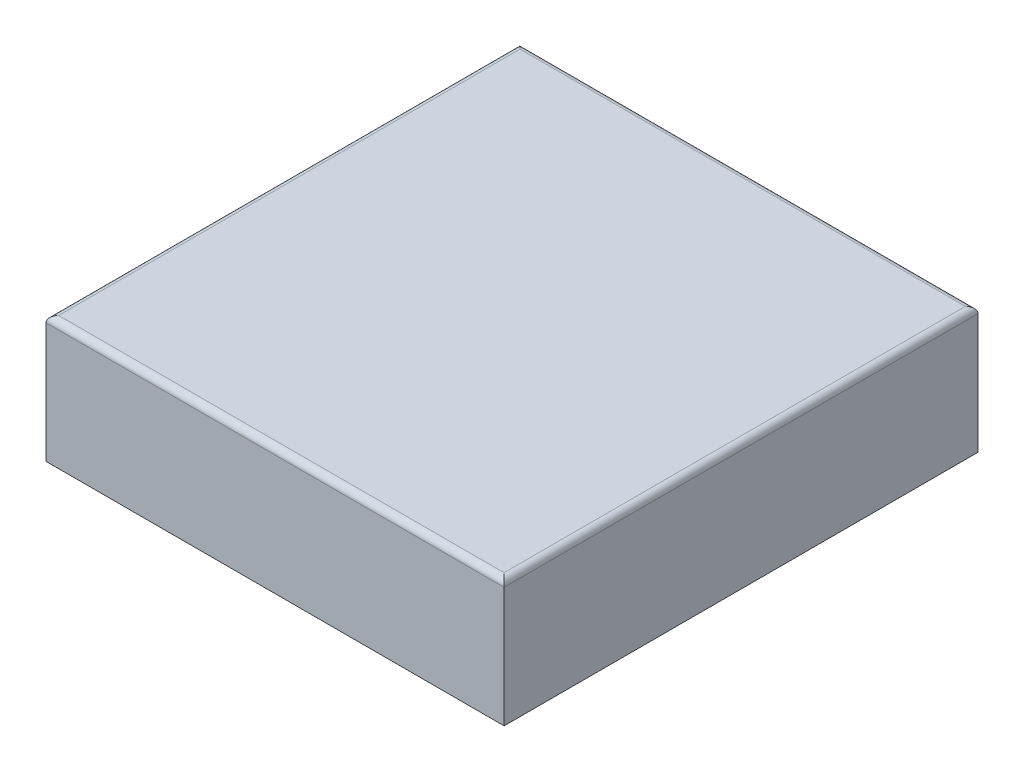
from build123d import *

# Parameters (mm, degrees)
SKETCH2_W                                            = 184.15
SKETCH2_H                                            = 190.5
BOSS_EXTRUDE1_DEPTH                                  = 50.8
SHELL1_T                                             = -5.08
CSK_FOR_M6_HEX_SOCKET_COUNTERSUNK_CAP_SC_D           = 6.6
CSK_FOR_M6_HEX_SOCKET_COUNTERSUNK_CAP_SC_DEPTH       = 11.733159957
CSK_FOR_M6_HEX_SOCKET_COUNTERSUNK_CAP_SC_CSINK_D     = 13.44
CSK_FOR_M6_HEX_SOCKET_COUNTERSUNK_CAP_SC_CSINK_ANGLE = 90
CSK_FOR_M6_HEX_SOCKET_COUNTERSUNK_CAP_SC_TIP         = 1.982840043
FILLET1_R                                            = 2.54


with BuildPart() as part:
    # Sketch2 → Boss-Extrude1 (new body)
    with BuildSketch(Plane(origin=(0, 0, 0), x_dir=(1, 0, 0), z_dir=(0, 1, 0))):
        Rectangle(SKETCH2_W, SKETCH2_H)
    extrude(amount=-BOSS_EXTRUDE1_DEPTH)

    # Shell1
    shell1_openings = [part.faces().sort_by_distance(p)[0] for p in [
        (0, -50.8, 0),
    ]]
    offset(amount=SHELL1_T, openings=shell1_openings, kind=Kind.INTERSECTION)

    # Loft1: read off the stored shape, not the designer's step
    # Loft1: loft between two sections, ruled curve by curve
    loft1_from = [
        Edge.make_bspline([(68.241223487, -26.310119776, -101.6), (68.532768976, -26.616911457, -101.6), (68.863871753, -26.909333008, -101.6), (69.601572379, -27.439191099, -101.6), (70.008225028, -27.676441112, -101.6), (70.882099248, -28.069631586, -101.6), (71.349251098, -28.225355381, -101.6), (72.31767022, -28.435607084, -101.6), (72.818735502, -28.489985667, -101.6), (73.821125836, -28.489985667, -101.6), (74.322191118, -28.435607084, -101.6), (75.29061024, -28.225355381, -101.6), (75.757762089, -28.069631586, -101.6), (76.631636309, -27.676441112, -101.6), (77.038288959, -27.439191099, -101.6), (77.775989584, -26.909333008, -101.6), (78.107092362, -26.616911457, -101.6), (78.39863785, -26.310119776, -101.6)], [0, 0, 0, 0, 0.125, 0.125, 0.25, 0.25, 0.375, 0.375, 0.5, 0.5, 0.625, 0.625, 0.75, 0.75, 0.875, 0.875, 1, 1, 1, 1], 3),
        Edge.make_bspline([(78.39863785, -26.310119776, -101.6), (78.675694815, -26.018574288, -101.6), (78.937226358, -25.692808769, -101.6), (79.407739121, -24.977845102, -101.6), (79.616581189, -24.588623733, -101.6), (79.961046476, -23.760489668, -101.6), (80.096520237, -23.321639377, -101.6), (80.279103538, -22.416392759, -101.6), (80.326114413, -21.950142771, -101.6), (80.326114413, -21.017461075, -101.6), (80.279103538, -20.551211086, -101.6), (80.096520237, -19.645964468, -101.6), (79.961046476, -19.207114178, -101.6), (79.616581189, -18.378980112, -101.6), (79.407739121, -17.989758743, -101.6), (78.937226358, -17.274795077, -101.6), (78.675694815, -16.949029558, -101.6), (78.39863785, -16.657484069, -101.6)], [0, 0, 0, 0, 0.125, 0.125, 0.25, 0.25, 0.375, 0.375, 0.5, 0.5, 0.625, 0.625, 0.75, 0.75, 0.875, 0.875, 1, 1, 1, 1], 3),
        Edge.make_bspline([(68.241223487, -16.657484069, -101.6), (67.964166523, -16.949029558, -101.6), (67.70263498, -17.274795077, -101.6), (67.232122217, -17.989758743, -101.6), (67.023280149, -18.378980112, -101.6), (66.678814862, -19.207114178, -101.6), (66.543341101, -19.645964468, -101.6), (66.3607578, -20.551211086, -101.6), (66.313746925, -21.017461075, -101.6), (66.313746925, -21.950142771, -101.6), (66.3607578, -22.416392759, -101.6), (66.543341101, -23.321639377, -101.6), (66.678814862, -23.760489668, -101.6), (67.023280149, -24.588623733, -101.6), (67.232122217, -24.977845102, -101.6), (67.70263498, -25.692808769, -101.6), (67.964166523, -26.018574288, -101.6), (68.241223487, -26.310119776, -101.6)], [0, 0, 0, 0, 0.125, 0.125, 0.25, 0.25, 0.375, 0.375, 0.5, 0.5, 0.625, 0.625, 0.75, 0.75, 0.875, 0.875, 1, 1, 1, 1], 3),
        Edge.make_bspline([(78.39863785, -16.657484069, -101.6), (78.107092362, -16.350692388, -101.6), (77.775989584, -16.058270838, -101.6), (77.038288959, -15.528412746, -101.6), (76.631636309, -15.291162733, -101.6), (75.757762089, -14.89797226, -101.6), (75.29061024, -14.742248464, -101.6), (74.322191118, -14.531996762, -101.6), (73.821125836, -14.477618178, -101.6), (72.818735502, -14.477618178, -101.6), (72.31767022, -14.531996762, -101.6), (71.349251098, -14.742248464, -101.6), (70.882099248, -14.89797226, -101.6), (70.008225028, -15.291162733, -101.6), (69.601572379, -15.528412746, -101.6), (68.863871753, -16.058270838, -101.6), (68.532768976, -16.350692388, -101.6), (68.241223487, -16.657484069, -101.6)], [0, 0, 0, 0, 0.125, 0.125, 0.25, 0.25, 0.375, 0.375, 0.5, 0.5, 0.625, 0.625, 0.75, 0.75, 0.875, 0.875, 1, 1, 1, 1], 3),
    ]
    loft1_to = [
        Edge.make_bspline([(62.059516528, -35.333897225, -95.25), (63.205579438, -35.333897225, -95.25), (64.351642348, -35.333897225, -95.25), (66.643768167, -35.333897225, -95.25), (67.789831077, -35.333897225, -95.25), (70.081956897, -35.333897225, -95.25), (71.228019807, -35.333897225, -95.25), (73.520145626, -35.333897225, -95.25), (74.666208536, -35.333897225, -95.25), (76.958334356, -35.333897225, -95.25), (78.104397266, -35.333897225, -95.25), (80.396523085, -35.333897225, -95.25), (81.542585995, -35.333897225, -95.25), (83.834711815, -35.333897225, -95.25), (84.980774725, -35.333897225, -95.25), (87.272900544, -35.333897225, -95.25), (88.418963454, -35.333897225, -95.25), (89.565026364, -35.333897225, -95.25)], [0, 0, 0, 0, 0.125, 0.125, 0.25, 0.25, 0.375, 0.375, 0.5, 0.5, 0.625, 0.625, 0.75, 0.75, 0.875, 0.875, 1, 1, 1, 1], 3),
        Edge.make_bspline([(89.565026364, -35.333897225, -95.25), (89.565026364, -34.244788582, -95.25), (89.565026364, -33.15567994, -95.25), (89.565026364, -30.977462655, -95.25), (89.565026364, -29.888354013, -95.25), (89.565026364, -27.710136729, -95.25), (89.565026364, -26.621028086, -95.25), (89.565026364, -24.442810802, -95.25), (89.565026364, -23.353702159, -95.25), (89.565026364, -21.175484875, -95.25), (89.565026364, -20.086376233, -95.25), (89.565026364, -17.908158948, -95.25), (89.565026364, -16.819050306, -95.25), (89.565026364, -14.640833021, -95.25), (89.565026364, -13.551724379, -95.25), (89.565026364, -11.373507094, -95.25), (89.565026364, -10.284398452, -95.25), (89.565026364, -9.19528981, -95.25)], [0, 0, 0, 0, 0.125, 0.125, 0.25, 0.25, 0.375, 0.375, 0.5, 0.5, 0.625, 0.625, 0.75, 0.75, 0.875, 0.875, 1, 1, 1, 1], 3),
        Edge.make_bspline([(62.059516528, -9.19528981, -95.25), (62.059516528, -10.284398452, -95.25), (62.059516528, -11.373507094, -95.25), (62.059516528, -13.551724379, -95.25), (62.059516528, -14.640833021, -95.25), (62.059516528, -16.819050306, -95.25), (62.059516528, -17.908158948, -95.25), (62.059516528, -20.086376233, -95.25), (62.059516528, -21.175484875, -95.25), (62.059516528, -23.353702159, -95.25), (62.059516528, -24.442810802, -95.25), (62.059516528, -26.621028086, -95.25), (62.059516528, -27.710136729, -95.25), (62.059516528, -29.888354013, -95.25), (62.059516528, -30.977462655, -95.25), (62.059516528, -33.15567994, -95.25), (62.059516528, -34.244788582, -95.25), (62.059516528, -35.333897225, -95.25)], [0, 0, 0, 0, 0.125, 0.125, 0.25, 0.25, 0.375, 0.375, 0.5, 0.5, 0.625, 0.625, 0.75, 0.75, 0.875, 0.875, 1, 1, 1, 1], 3),
        Edge.make_bspline([(89.565026364, -9.19528981, -95.25), (88.418963454, -9.19528981, -95.25), (87.272900544, -9.19528981, -95.25), (84.980774725, -9.19528981, -95.25), (83.834711815, -9.19528981, -95.25), (81.542585995, -9.19528981, -95.25), (80.396523085, -9.19528981, -95.25), (78.104397266, -9.19528981, -95.25), (76.958334356, -9.19528981, -95.25), (74.666208536, -9.19528981, -95.25), (73.520145626, -9.19528981, -95.25), (71.228019807, -9.19528981, -95.25), (70.081956897, -9.19528981, -95.25), (67.789831077, -9.19528981, -95.25), (66.643768167, -9.19528981, -95.25), (64.351642348, -9.19528981, -95.25), (63.205579438, -9.19528981, -95.25), (62.059516528, -9.19528981, -95.25)], [0, 0, 0, 0, 0.125, 0.125, 0.25, 0.25, 0.375, 0.375, 0.5, 0.5, 0.625, 0.625, 0.75, 0.75, 0.875, 0.875, 1, 1, 1, 1], 3),
    ]
    loft1 = Solid(Shell([*[Face.make_surface_from_curves(loft1_from[k], loft1_to[k]) for k in range(4)], Face(Wire(loft1_from)), Face(Wire(loft1_to))]))
    add(loft1)

    # CSK for M6 Hex Socket Countersunk Cap Screw1
    with Locations(Plane(origin=(0, 0, -101.6), x_dir=(-1, 0, 0), z_dir=(0, 0, -1))):
        with Locations((-73.319930669, -21.483801923)):
            CounterSinkHole(CSK_FOR_M6_HEX_SOCKET_COUNTERSUNK_CAP_SC_D / 2, CSK_FOR_M6_HEX_SOCKET_COUNTERSUNK_CAP_SC_CSINK_D / 2, depth=CSK_FOR_M6_HEX_SOCKET_COUNTERSUNK_CAP_SC_DEPTH, counter_sink_angle=CSK_FOR_M6_HEX_SOCKET_COUNTERSUNK_CAP_SC_CSINK_ANGLE)
            with Locations((0, 0, -(CSK_FOR_M6_HEX_SOCKET_COUNTERSUNK_CAP_SC_DEPTH + CSK_FOR_M6_HEX_SOCKET_COUNTERSUNK_CAP_SC_TIP / 2))):  # 118° drill point
                Cone(0, CSK_FOR_M6_HEX_SOCKET_COUNTERSUNK_CAP_SC_D / 2, CSK_FOR_M6_HEX_SOCKET_COUNTERSUNK_CAP_SC_TIP, mode=Mode.SUBTRACT)

    # Fillet1
    fillet1_edges = [part.edges().sort_by_distance(p)[0] for p in [
        (0, 0, 95.25),
        (-92.075, 0, 0),
        (0, 0, -95.25),
        (92.075, 0, 0),
    ]]
    fillet(fillet1_edges, radius=FILLET1_R)


solid = part.part
